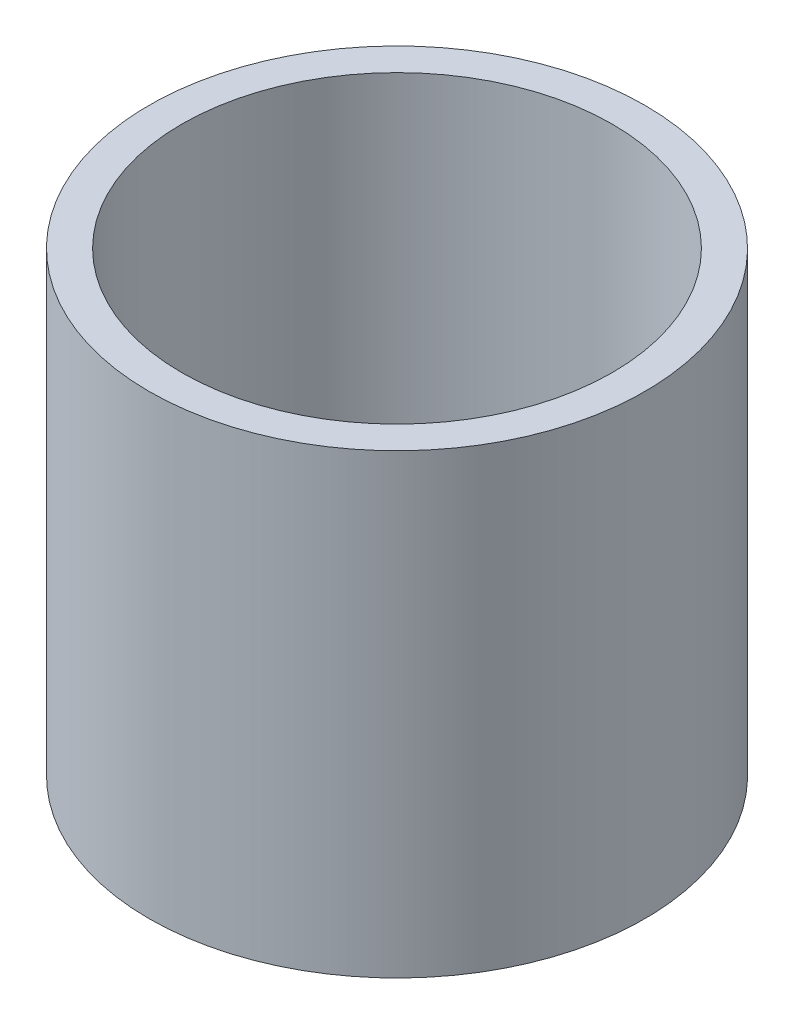
from build123d import *

# Parameters (mm, degrees)
SKETCH_1_R      = 19
EXTRUDE_1_DEPTH = 5
SKETCH_2_R      = 19
SKETCH_2_R_2    = 16.5
EXTRUDE_2_DEPTH = 30


with BuildPart() as part:
    # Эскиз1 → Бобышка-Вытянуть1 (new body)
    with BuildSketch(Plane(origin=(0, 0, 0), x_dir=(1, 0, 0), z_dir=(0, 1, 0))):
        Circle(SKETCH_1_R)
    extrude(amount=EXTRUDE_1_DEPTH)

    # Эскиз2 → Бобышка-Вытянуть2 (add)
    with BuildSketch(Plane(origin=(0, 5, 0), x_dir=(1, 0, 0), z_dir=(0, 1, 0))):
        Circle(SKETCH_2_R)
        Circle(SKETCH_2_R_2, mode=Mode.SUBTRACT)
    extrude(amount=EXTRUDE_2_DEPTH)


solid = part.part
